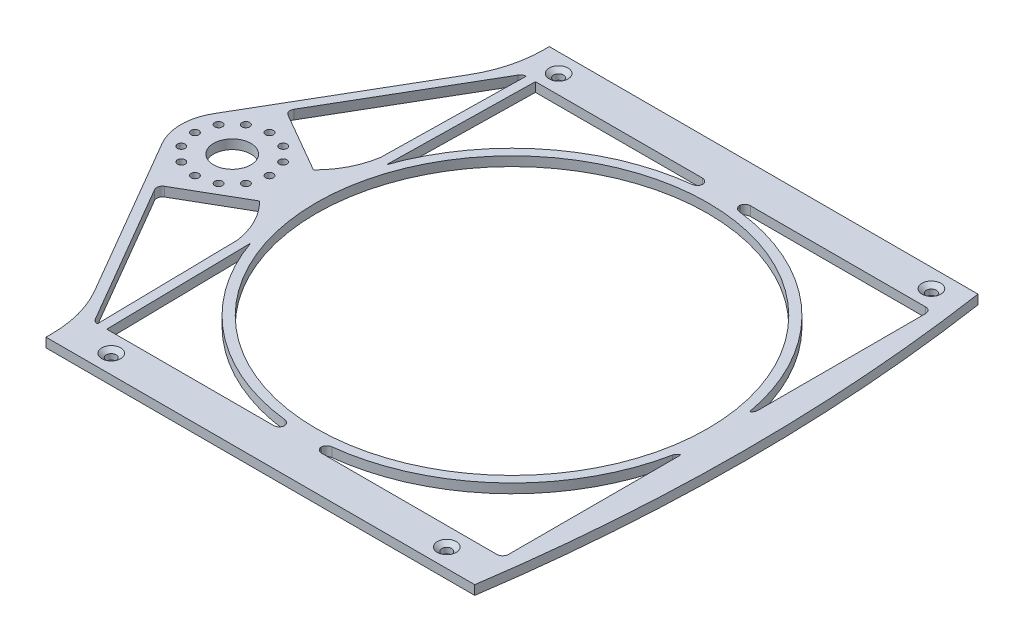
from build123d import *

# Parameters (mm, degrees)
SKETCH1_R                                           = 133.35
SKETCH1_R_2                                         = 12.7
SKETCH1_R_3                                         = 2.6289
EXTRUDE_CENTER_HOLE_DEPTH                           = 6.35
CSK_FOR_1_4_FLAT_HEAD_MACHINE_SCREW_100_D           = 6.7564
CSK_FOR_1_4_FLAT_HEAD_MACHINE_SCREW_100_CSINK_D     = 12.8778
CSK_FOR_1_4_FLAT_HEAD_MACHINE_SCREW_100_CSINK_ANGLE = 100
FILLET1_R                                           = 79.796453401
SLOTTING_DEPTH                                      = 284.386633253
FILLET5_R                                           = 3.96875
FILLET6_R                                           = 3.96875
FILLET7_R                                           = 3.96875
FILLET8_R                                           = 3.96875
MOTOR_SIDE_SUPPORTS_DEPTH                           = 6.35
OPPOSITE_MOTOR_SIDE_THICKENING_DEPTH                = 6.35
MOTOR_SIDE_THICKENING_DEPTH                         = 6.35


with BuildPart() as part:
    # Sketch1 → Extrude & center hole (new body)
    with BuildSketch(Plane(origin=(0, 0, 0), x_dir=(1, 0, 0), z_dir=(0, 1, 0))):
        with BuildLine():
            Line((0, 171.45), (146.05, 171.45))
            Line((146.05, 171.45), (146.05, 0))
            Line((146.05, 0), (146.05, -171.45))
            Line((146.05, -171.45), (-146.05, -171.45))
            Line((-146.05, -171.45), (-146.05, -146.05))
            Line((-146.05, -146.05), (-220.811204994, -17.564625007))
            ThreePointArc((-220.811204994, -17.564625007), (-225.54946, 0), (-220.811204994, 17.564625007))
            Line((-220.811204994, 17.564625007), (-146.05, 146.05))
            Line((-146.05, 146.05), (-146.05, 171.45))
            Line((-146.05, 171.45), (0, 171.45))
        make_face()
        with Locations(Location((0, 0, 0), (0, 0, 270))):
            Circle(SKETCH1_R, mode=Mode.SUBTRACT)
        with Locations(Location((-190.62446, 0, 0), (0, 0, 270))):
            Circle(SKETCH1_R_2, mode=Mode.SUBTRACT)
        with Locations(Location((-190.62446, 25.4, 0), (0, 0, 270))):
            Circle(SKETCH1_R_3, mode=Mode.SUBTRACT)
        with Locations(Location((-177.92446, 21.997045256, 0), (0, 0, 270))):
            Circle(SKETCH1_R_3, mode=Mode.SUBTRACT)
        with Locations(Location((-168.627414744, 12.7, 0), (0, 0, 270))):
            Circle(SKETCH1_R_3, mode=Mode.SUBTRACT)
        with Locations(Location((-165.22446, 0, 0), (0, 0, 270))):
            Circle(SKETCH1_R_3, mode=Mode.SUBTRACT)
        with Locations(Location((-168.627414744, -12.7, 0), (0, 0, 270))):
            Circle(SKETCH1_R_3, mode=Mode.SUBTRACT)
        with Locations(Location((-177.92446, -21.997045256, 0), (0, 0, 270))):
            Circle(SKETCH1_R_3, mode=Mode.SUBTRACT)
        with Locations(Location((-190.62446, -25.4, 0), (0, 0, 270))):
            Circle(SKETCH1_R_3, mode=Mode.SUBTRACT)
        with Locations(Location((-203.32446, -21.997045256, 0), (0, 0, 270))):
            Circle(SKETCH1_R_3, mode=Mode.SUBTRACT)
        with Locations(Location((-212.621505256, -12.7, 0), (0, 0, 270))):
            Circle(SKETCH1_R_3, mode=Mode.SUBTRACT)
        with Locations(Location((-216.02446, 0, 0), (0, 0, 270))):
            Circle(SKETCH1_R_3, mode=Mode.SUBTRACT)
        with Locations(Location((-212.621505256, 12.7, 0), (0, 0, 270))):
            Circle(SKETCH1_R_3, mode=Mode.SUBTRACT)
        with Locations(Location((-203.32446, 21.997045256, 0), (0, 0, 270))):
            Circle(SKETCH1_R_3, mode=Mode.SUBTRACT)
    extrude(amount=EXTRUDE_CENTER_HOLE_DEPTH)

    # CSK for 1/4 Flat Head Machine Screw (100)1 (through all)
    with Locations(Plane(origin=(0, 6.35, 0), x_dir=(1, 0, 0), z_dir=(0, 1, 0))):
        with Locations((-114.3, -158.75), (114.3, -158.75), (127, 158.75), (-127, 158.75)):
            CounterSinkHole(CSK_FOR_1_4_FLAT_HEAD_MACHINE_SCREW_100_D / 2, CSK_FOR_1_4_FLAT_HEAD_MACHINE_SCREW_100_CSINK_D / 2, counter_sink_angle=CSK_FOR_1_4_FLAT_HEAD_MACHINE_SCREW_100_CSINK_ANGLE)

    # Fillet1
    fillet1_edges = [part.edges().sort_by_distance(p)[0] for p in [
        (-146.05, 3.175, 146.05),
        (-146.05, 3.175, -146.05),
    ]]
    fillet(fillet1_edges, radius=FILLET1_R)

    # Sketch6 → Slotting (cut, through all)
    with BuildSketch(Plane(origin=(0, 6.35, 0), x_dir=(1, 0, 0), z_dir=(0, 1, 0))):
        with BuildLine():
            Line((-139.335459755, 10.085616241), (-198.081200359, 44.002485392))
            Line((-198.081200359, 44.002485392), (-138.703273811, 146.05))
            Line((-138.703273811, 146.05), (-12.777719308, 146.05))
            Line((-12.777719308, 146.05), (-12.175657262, 139.168399323))
            ThreePointArc((-12.175657262, 139.168399323), (-99.521333728, 98.03873792), (-139.335459755, 10.085616241))
        make_face()
        with BuildLine():
            Line((-198.081200359, -44.002485392), (-138.703273811, -146.05))
            Line((-138.703273811, -146.05), (-12.777719308, -146.05))
            Line((-12.777719308, -146.05), (-12.175657262, -139.168399323))
            ThreePointArc((-12.175657262, -139.168399323), (-99.521333728, -98.03873792), (-139.335459755, -10.085616241))
            Line((-139.335459755, -10.085616241), (-198.081200359, -44.002485392))
        make_face()
        with BuildLine():
            Line((139.7, 24.632879205), (139.7, 146.05))
            Line((139.7, 146.05), (12.777719308, 146.05))
            Line((12.777719308, 146.05), (12.175657262, 139.168399323))
            ThreePointArc((12.175657262, 139.168399323), (94.379952004, 102.997643952), (137.577643096, 24.25865042))
            Line((137.577643096, 24.25865042), (139.7, 24.632879205))
        make_face()
        with BuildLine():
            Line((137.577643096, -24.25865042), (139.7, -24.632879205))
            Line((139.7, -24.632879205), (139.7, -146.05))
            Line((139.7, -146.05), (12.777719308, -146.05))
            Line((12.777719308, -146.05), (12.175657262, -139.168399323))
            ThreePointArc((12.175657262, -139.168399323), (94.379952004, -102.997643952), (137.577643096, -24.25865042))
        make_face()
    extrude(amount=-SLOTTING_DEPTH, mode=Mode.SUBTRACT)

    # Fillet5
    # the kernel refuses this fillet: 3.96875 mm, written as the material it adds along each edge
    with BuildSketch(Plane(origin=(12.777719308, 6.35, 146.05), x_dir=(1, 0, 0), z_dir=(0, -1, 0))) as fillet5_piece_1:
        with BuildLine():
            CenterArc((FILLET5_R * 0.916331174017, -FILLET5_R), FILLET5_R, 90, 85)
            Line((-FILLET5_R * 0.0798635240743, -FILLET5_R * 0.912844257252), (-FILLET5_R * 0.0997874180362, -FILLET5_R * 0.911101142397))
            Line((-FILLET5_R * 0.0997874180362, -FILLET5_R * 0.911101142397), (-FILLET5_R * 0.0183266234803, FILLET5_R * 0.02))
            Line((-FILLET5_R * 0.0183266234803, FILLET5_R * 0.02), (FILLET5_R * 0.916331174017, FILLET5_R * 0.02))
            Line((FILLET5_R * 0.916331174017, FILLET5_R * 0.02), (FILLET5_R * 0.916331174017, 0))
        make_face()
    extrude(amount=6.35)
    with BuildSketch(Plane(origin=(139.7, 6.35, 146.05), x_dir=(0, 0, -1), z_dir=(0, -1, 0))) as fillet5_piece_2:
        with BuildLine():
            CenterArc((FILLET5_R, -FILLET5_R), FILLET5_R, 90, 90)
            Line((0, -FILLET5_R), (-FILLET5_R * 0.02, -FILLET5_R))
            Line((-FILLET5_R * 0.02, -FILLET5_R), (-FILLET5_R * 0.02, FILLET5_R * 0.02))
            Line((-FILLET5_R * 0.02, FILLET5_R * 0.02), (FILLET5_R, FILLET5_R * 0.02))
            Line((FILLET5_R, FILLET5_R * 0.02), (FILLET5_R, 0))
        make_face()
    extrude(amount=6.35)
    with BuildSketch(Plane(origin=(137.577643096, 6.35, 24.25865042), x_dir=(-0.1858109279548849, 0, 0.9825855174245877), z_dir=(0, -1, 0))) as fillet5_piece_3:
        with BuildLine():
            CenterArc((3.50353097, -3.968446647), FILLET5_R, 90.708414928, 62.101221503)
            Line((-0.026645322, -2.154932955), (-0.097248847, -2.118662681))
            ThreePointArc((-0.097248847, -2.118662681), (-0.092691594, -1.076485096), (-0.079368933, 0.000981381))
            Line((-0.079368933, 0.000981381), (0.000981381, 0.079368933))
            ThreePointArc((0.000981381, 0.079368933), (1.727230954, 0.068696973), (3.453480528, 0.079368933))
            Line((3.453480528, 0.079368933), (3.454461909, 0))
        make_face()
    extrude(amount=6.35)
    with BuildSketch(Plane(origin=(12.175657262, 6.35, 139.168399323), x_dir=(0.9948957271243674, 0, -0.10090833538254544), z_dir=(0, -1, 0))) as fillet5_piece_4:
        with BuildLine():
            CenterArc((3.914306477, 3.968371339), FILLET5_R, 180.791478855, 88.41704229)
            Line((-0.054064862, 3.91354912), (-0.133432289, 3.912452675))
            Line((-0.133432289, 3.912452675), (-0.079367427, -0.001096444))
            Line((-0.079367427, -0.001096444), (0.001096444, -0.079367427))
            ThreePointArc((0.001096444, -0.079367427), (1.929742129, -0.066046144), (3.858387813, -0.079367427))
            Line((3.858387813, -0.079367427), (3.859484258, 0))
        make_face()
    extrude(amount=6.35)

    # Fillet6
    # the kernel refuses this fillet: 3.96875 mm, written as the material it adds along each edge
    with BuildSketch(Plane(origin=(139.7, 6.35, -24.632879205), x_dir=(-0.9848077530122098, 0, 0.17364817766692084), z_dir=(0, -1, 0))) as fillet6_piece_1:
        with BuildLine():
            CenterArc((3.363398048, 3.780342152), FILLET6_R, 190, 62.274703633)
            Line((-0.545057721, 3.091175947), (-0.623226837, 3.077392622))
            Line((-0.623226837, 3.077392622), (-0.078169115, -0.013783324))
            Line((-0.078169115, -0.013783324), (0, -0.079375))
            ThreePointArc((0, -0.079375), (1.07754884, -0.079375), (2.130931673, -0.075606843))
            Line((2.130931673, -0.075606843), (2.15509768, 0))
        make_face()
    extrude(amount=6.35)
    with BuildSketch(Plane(origin=(139.7, 6.35, -146.05), x_dir=(-1, 0, 0), z_dir=(0, -1, 0))) as fillet6_piece_2:
        with BuildLine():
            CenterArc((FILLET6_R, -FILLET6_R), FILLET6_R, 90, 90)
            Line((0, -FILLET6_R), (-FILLET6_R * 0.02, -FILLET6_R))
            Line((-FILLET6_R * 0.02, -FILLET6_R), (-FILLET6_R * 0.02, FILLET6_R * 0.02))
            Line((-FILLET6_R * 0.02, FILLET6_R * 0.02), (FILLET6_R, FILLET6_R * 0.02))
            Line((FILLET6_R, FILLET6_R * 0.02), (FILLET6_R, 0))
        make_face()
    extrude(amount=6.35)
    with BuildSketch(Plane(origin=(12.175657262, 6.35, -139.168399323), x_dir=(0.9948957271243674, 0, 0.10090833538254544), z_dir=(0, -1, 0))) as fillet6_piece_3:
        with BuildLine():
            CenterArc((3.914306477, -3.968371339), FILLET6_R, 90.791478855, 88.41704229)
            Line((-0.054064862, -3.91354912), (-0.133432289, -3.912452675))
            Line((-0.133432289, -3.912452675), (-0.079367427, 0.001096444))
            Line((-0.079367427, 0.001096444), (0.001096444, 0.079367427))
            ThreePointArc((0.001096444, 0.079367427), (1.929742129, 0.066046144), (3.858387813, 0.079367427))
            Line((3.858387813, 0.079367427), (3.859484258, 0))
        make_face()
    extrude(amount=6.35)
    with BuildSketch(Plane(origin=(12.777719308, 6.35, -146.05), x_dir=(-0.0871557427476581, 0, 0.9961946980917455), z_dir=(0, -1, 0))) as fillet6_piece_4:
        with BuildLine():
            CenterArc((FILLET6_R * 0.916331174017, -FILLET6_R), FILLET6_R, 90, 85)
            Line((-FILLET6_R * 0.0798635240743, -FILLET6_R * 0.912844257252), (-FILLET6_R * 0.0997874180361, -FILLET6_R * 0.911101142397))
            Line((-FILLET6_R * 0.0997874180361, -FILLET6_R * 0.911101142397), (-FILLET6_R * 0.0183266234803, FILLET6_R * 0.02))
            Line((-FILLET6_R * 0.0183266234803, FILLET6_R * 0.02), (FILLET6_R * 0.916331174017, FILLET6_R * 0.02))
            Line((FILLET6_R * 0.916331174017, FILLET6_R * 0.02), (FILLET6_R * 0.916331174017, 0))
        make_face()
    extrude(amount=6.35)

    # Fillet7
    # the kernel refuses this fillet: 3.96875 mm, written as the material it adds along each edge
    with BuildSketch(Plane(origin=(-139.335459755, 6.35, -10.085616241), x_dir=(-0.8660254037844399, 0, -0.4999999999999978), z_dir=(0, -1, 0))) as fillet7_piece_1:
        with BuildLine():
            CenterArc((6.18207927, 3.96875), FILLET7_R, 156.640476374, 113.359523626)
            ThreePointArc((2.538628022, 5.542357182), (1.299549112, 2.757329669), (0, 0))
            Line((0, 0), (6.18207927, 0))
        make_face()
    extrude(amount=6.35)
    with BuildSketch(Plane(origin=(-198.081200359, 6.35, -44.002485392), x_dir=(0.5029241233239898, 0, -0.8643305653387461), z_dir=(0, -1, 0))) as fillet7_piece_2:
        with BuildLine():
            CenterArc((FILLET7_R * 1.00338551513, FILLET7_R), FILLET7_R, 179.806352255, 90.193647745)
            Line((FILLET7_R * 0.00339122661612, FILLET7_R * 1.00337978431), (0, 0))
            Line((0, 0), (FILLET7_R * 1.00338551513, 0))
        make_face()
    extrude(amount=6.35)
    with BuildSketch(Plane(origin=(-138.703273811, 6.35, -146.05), x_dir=(1, 0, 0), z_dir=(0, -1, 0))) as fillet7_piece_3:
        with BuildLine():
            CenterArc((FILLET7_R * 0.575099269434, FILLET7_R), FILLET7_R, 210.193647745, 59.806352255)
            Line((-FILLET7_R * 0.289231295904, FILLET7_R * 0.497075876676), (0, 0))
            Line((0, 0), (FILLET7_R * 0.575099269434, 0))
        make_face()
    extrude(amount=6.35)
    with BuildSketch(Plane(origin=(-12.175657262, 6.35, -139.168399323), x_dir=(-0.08715574274765879, 0, -0.9961946980917455), z_dir=(0, -1, 0))) as fillet7_piece_4:
        with BuildLine():
            CenterArc((3.913922549, -3.96875), FILLET7_R, 90, 88.41704229)
            ThreePointArc((-0.05331288, -3.859116022), (-0.013328856, -1.929742129), (0, 0))
            Line((0, 0), (3.913922549, 0))
        make_face()
    extrude(amount=6.35)
    with BuildSketch(Plane(origin=(-12.777719308, 6.35, -146.05), x_dir=(-1, 0, 0), z_dir=(0, -1, 0))) as fillet7_piece_5:
        with BuildLine():
            CenterArc((FILLET7_R * 0.916331174017, -FILLET7_R), FILLET7_R, 90, 85)
            Line((-FILLET7_R * 0.0798635240743, -FILLET7_R * 0.912844257252), (0, 0))
            Line((0, 0), (FILLET7_R * 0.916331174017, 0))
        make_face()
    extrude(amount=6.35)

    # Fillet8
    # the kernel refuses this fillet: 3.96875 mm, written as the material it adds along each edge
    with BuildSketch(Plane(origin=(-138.703273811, 6.35, 146.05), x_dir=(1, 0, 0), z_dir=(0, -1, 0))) as fillet8_piece_1:
        with BuildLine():
            CenterArc((FILLET8_R * 0.575099269434, -FILLET8_R), FILLET8_R, 90, 59.806352255)
            Line((-FILLET8_R * 0.289231295904, -FILLET8_R * 0.497075876676), (0, 0))
            Line((0, 0), (FILLET8_R * 0.575099269434, 0))
        make_face()
    extrude(amount=6.35)
    with BuildSketch(Plane(origin=(-12.777719308, 6.35, 146.05), x_dir=(0.08715574274765858, 0, -0.9961946980917455), z_dir=(0, -1, 0))) as fillet8_piece_2:
        with BuildLine():
            CenterArc((FILLET8_R * 0.916331174017, -FILLET8_R), FILLET8_R, 90, 85)
            Line((-FILLET8_R * 0.0798635240743, -FILLET8_R * 0.912844257252), (0, 0))
            Line((0, 0), (FILLET8_R * 0.916331174017, 0))
        make_face()
    extrude(amount=6.35)
    with BuildSketch(Plane(origin=(-12.175657262, 6.35, 139.168399323), x_dir=(-0.08715574274765799, 0, 0.9961946980917455), z_dir=(0, -1, 0))) as fillet8_piece_3:
        with BuildLine():
            CenterArc((3.913922549, 3.96875), FILLET8_R, 181.58295771, 88.41704229)
            ThreePointArc((-0.05331288, 3.859116022), (-0.013328856, 1.929742129), (0, 0))
            Line((0, 0), (3.913922549, 0))
        make_face()
    extrude(amount=6.35)
    with BuildSketch(Plane(origin=(-139.335459755, 6.35, 10.085616241), x_dir=(0.09393921500732419, 0, 0.9955779346107505), z_dir=(0, -1, 0))) as fillet8_piece_4:
        with BuildLine():
            CenterArc((6.182685688, 3.96780523), FILLET8_R, 155.390268268, 113.359523626)
            Line((2.574435545, 5.620532513), (0, 0))
            ThreePointArc((0, 0), (3.048046726, 0.033255887), (6.096093452, 0))
        make_face()
    extrude(amount=6.35)
    with BuildSketch(Plane(origin=(-198.081200359, 6.35, 44.002485392), x_dir=(0.5029241233239921, 0, 0.8643305653387446), z_dir=(0, -1, 0))) as fillet8_piece_5:
        with BuildLine():
            CenterArc((FILLET8_R * 1.00338551513, -FILLET8_R), FILLET8_R, 90, 90.193647745)
            Line((FILLET8_R * 0.00339122661611, -FILLET8_R * 1.00337978431), (0, 0))
            Line((0, 0), (FILLET8_R * 1.00338551513, 0))
        make_face()
    extrude(amount=6.35)

    # Sketch7 → Motor side supports (add)
    with BuildSketch(Plane(origin=(0, 6.35, 0), x_dir=(1, 0, 0), z_dir=(0, 1, 0))):
        with BuildLine():
            Line((-138.675364887, 16.888847605), (-136.420848586, 146.05))
            Line((-136.420848586, 146.05), (-130.069881303, 146.05))
            Line((-130.069881303, 146.05), (-131.811370449, 46.280153634))
            ThreePointArc((-131.811370449, 46.280153634), (-136.03944544, 31.770415237), (-138.675364887, 16.888847605))
        make_face()
        with BuildLine():
            Line((-138.675364887, -16.888847605), (-136.420848586, -146.05))
            Line((-136.420848586, -146.05), (-130.069881303, -146.05))
            Line((-130.069881303, -146.05), (-131.811370449, -46.280153634))
            ThreePointArc((-131.811370449, -46.280153634), (-136.03944544, -31.770415237), (-138.675364887, -16.888847605))
        make_face()
    extrude(amount=-MOTOR_SIDE_SUPPORTS_DEPTH)

    # Sketch9 → Opposite motor side thickening (add)
    with BuildSketch(Plane(origin=(0, 6.35, 0), x_dir=(1, 0, 0), z_dir=(0, 1, 0))):
        with BuildLine():
            Line((146.05, 171.45), (146.05, -171.45))
            ThreePointArc((146.05, -171.45), (158.75, 0), (146.05, 171.45))
        make_face()
    extrude(amount=-OPPOSITE_MOTOR_SIDE_THICKENING_DEPTH)

    # Sketch10 → Motor side thickening (add)
    with BuildSketch(Plane(origin=(0, 6.35, 0), x_dir=(1, 0, 0), z_dir=(0, 1, 0))):
        with BuildLine():
            Line((-138.122689066, 48.551624174), (-138.675364887, 16.888847605))
            ThreePointArc((-138.675364887, 16.888847605), (-138.719566803, 16.521857823), (-138.762797521, 16.154752368))
            ThreePointArc((-138.762797521, 16.154752368), (-140.922940162, 13.067496841), (-144.689297451, 13.176655876))
            Line((-144.689297451, 13.176655876), (-153.609478479, 18.326724794))
            ThreePointArc((-153.609478479, 18.326724794), (-143.451229081, 32.201838816), (-138.122689066, 48.551624174))
        make_face()
        with BuildLine():
            Line((-153.609478479, -18.326724794), (-144.689297451, -13.176655876))
            ThreePointArc((-144.689297451, -13.176655876), (-140.922940162, -13.067496841), (-138.762797521, -16.154752368))
            ThreePointArc((-138.762797521, -16.154752368), (-138.719566803, -16.521857823), (-138.675364887, -16.888847605))
            Line((-138.675364887, -16.888847605), (-138.122689066, -48.551624174))
            ThreePointArc((-138.122689066, -48.551624174), (-143.451229081, -32.201838816), (-153.609478479, -18.326724794))
        make_face()
    extrude(amount=-MOTOR_SIDE_THICKENING_DEPTH)


solid = part.part
